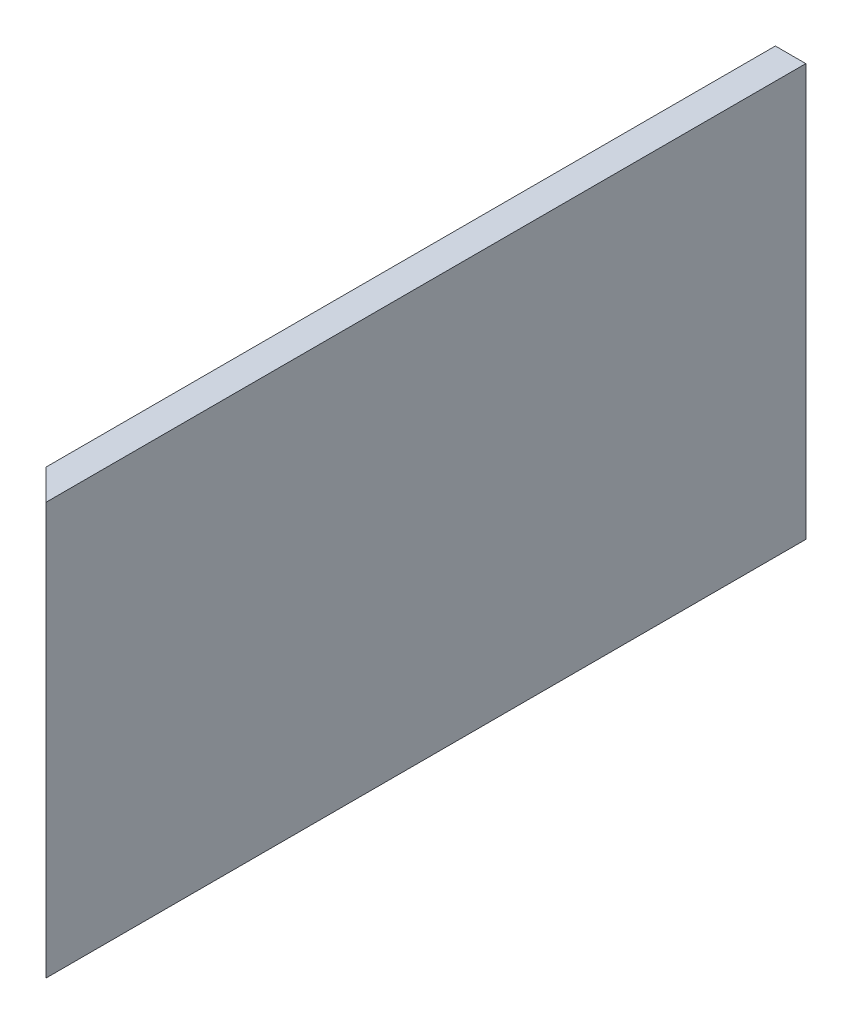
from build123d import *

# Parameters (mm, degrees)
BOSS_EXTRUDE2_REACH = 554.761
SKETCH2_W           = 12.7
SKETCH2_H           = 171.7294


with BuildPart() as part:
    # Boss-Extrude2: up to this plane
    boss_extrude2_end = Plane(origin=(0, 0, 0), z_dir=(-0.7071067811865475, 0, 0.7071067811865477))
    # Sketch2 → Boss-Extrude2 (new, up to the surface)
    with BuildSketch(Plane.XY, mode=Mode.PRIVATE) as boss_extrude2_sk1:
        with Locations((310.2356, 85.8647)):
            Rectangle(SKETCH2_W, SKETCH2_H)
    boss_extrude2_tool1 = split(extrude(boss_extrude2_sk1.sketch, amount=BOSS_EXTRUDE2_REACH, mode=Mode.PRIVATE), bisect_by=boss_extrude2_end, keep=Keep.BOTH, mode=Mode.PRIVATE)
    add(boss_extrude2_tool1.solids().sort_by_distance((310.2356, 85.8647, 0))[0])


solid = part.part
